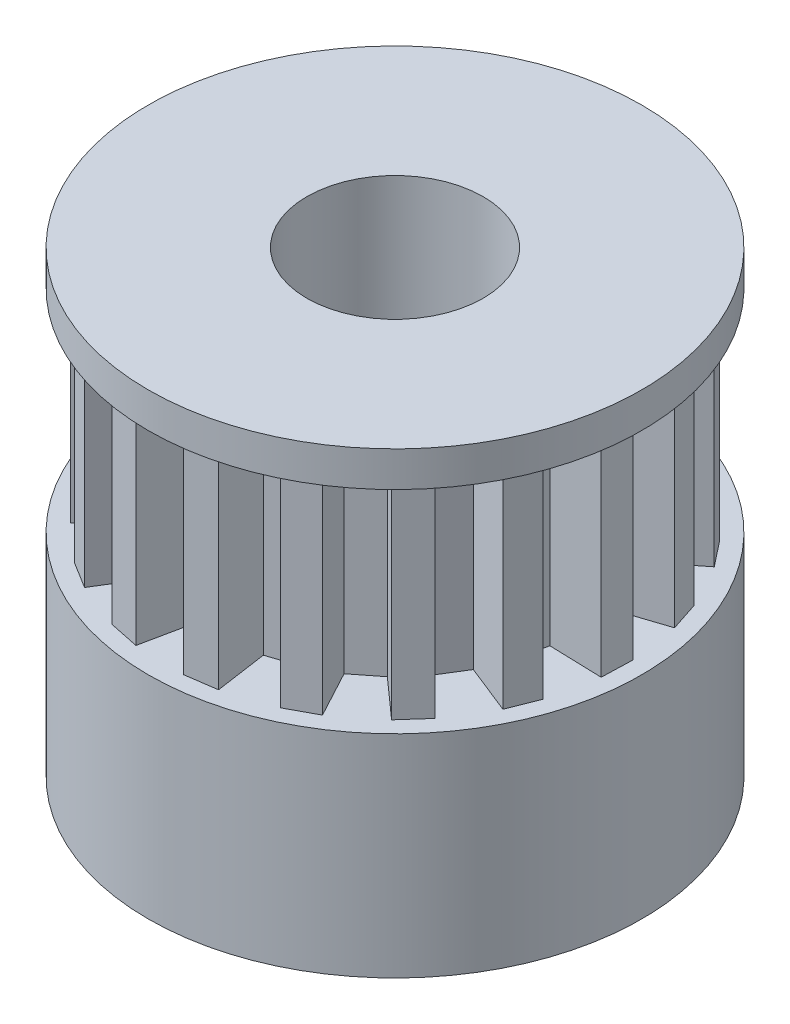
from build123d import *

# Parameters (mm, degrees)
ESTRUSIONE_ESTRUSIONE1_OUTLINE_R = 2.5
ESTRUSIONE_ESTRUSIONE1_DEPTH     = 6
SCHIZZO2_R                       = 7
ESTRUSIONE_ESTRUSIONE2_DEPTH     = 1
FORI_FILETTATI_5_0MM1_D          = 5
ESTRUSIONE_ESTRUSIONE3_START     = 6
SCHIZZO4_R                       = 7
ESTRUSIONE_ESTRUSIONE3_DEPTH     = 6
FORI_FILETTATI_5_0MM2_D          = 5
FORI_FILETTATI_5_0MM2_DEPTH      = 10
FORI_FILETTATI_5_0MM2_TIP        = 1.502151548


# Read off the part's stored shape, not the designer's step: Estrusione-Estrusione1
with BuildPart() as part:
    # Estrusione-Estrusione1 outline → Estrusione-Estrusione1 (new body)
    with BuildSketch(Plane(origin=(0, 0, 0), x_dir=(1, 0, 0), z_dir=(0, 1, 0))):
        Polygon((-4.558413324, 4.655107649), (-5.141001385, 4.002407278), (-4.021493725, 3.00315582), (-4.481890734, 2.259206078), (-5.875647949, 2.815301129), (-6.199864976, 2.002706553), (-4.806107761, 1.446611503), (-4.984293637, 0.590062369), (-6.484192715, 0.635927742), (-6.51093335, -0.238550138), (-5.011034272, -0.284415511), (-4.885517166, -1.15025157), (-6.310648144, -1.620147915), (-6.036687071, -2.451034162), (-4.611556094, -1.981137817), (-4.197475223, -2.751828193), (-5.375946271, -3.680809823), (-4.83432724, -4.367887293), (-3.655856192, -3.438905663), (-3.00315582, -4.021493725), (-3.792825937, -5.297511743), (-3.048876196, -5.757908753), (-2.259206078, -4.481890734), (-1.446611503, -4.806107761), (-1.75223482, -6.275255564), (-0.895685686, -6.45344144), (-0.590062369, -4.984293637), (0.284415511, -5.011034272), (0.499701678, -6.496110952), (1.365537736, -6.370593846), (1.15025157, -4.885517166), (1.981137817, -4.611556094), (2.691366778, -5.933439486), (3.462057155, -5.519358615), (2.751828193, -4.197475223), (3.438905663, -3.655856192), (4.558413324, -4.655107649), (5.141001385, -4.002407278), (4.021493725, -3.00315582), (4.481890734, -2.259206078), (5.875647949, -2.815301129), (6.199864976, -2.002706553), (4.806107761, -1.446611503), (4.984293637, -0.590062369), (6.484192715, -0.635927742), (6.51093335, 0.238550138), (5.011034272, 0.284415511), (4.885517166, 1.15025157), (6.310648144, 1.620147915), (6.036687071, 2.451034162), (4.611556094, 1.981137817), (4.197475223, 2.751828193), (5.375946271, 3.680809823), (4.83432724, 4.367887293), (3.655856192, 3.438905663), (3.00315582, 4.021493725), (3.792825937, 5.297511743), (3.048876196, 5.757908753), (2.259206078, 4.481890734), (1.446611503, 4.806107761), (1.75223482, 6.275255564), (0.895685686, 6.45344144), (0.590062369, 4.984293637), (-0.284415511, 5.011034272), (-0.499701678, 6.496110952), (-1.365537736, 6.370593846), (-1.15025157, 4.885517166), (-1.981137817, 4.611556094), (-2.691366778, 5.933439486), (-3.462057155, 5.519358615), (-2.751828193, 4.197475223), (-3.438905663, 3.655856192), align=None)
        Circle(ESTRUSIONE_ESTRUSIONE1_OUTLINE_R, mode=Mode.SUBTRACT)
    extrude(amount=ESTRUSIONE_ESTRUSIONE1_DEPTH)

    # Schizzo2 → Estrusione-Estrusione2 (add)
    with BuildSketch(Plane(origin=(0, 6, 0), x_dir=(1, 0, 0), z_dir=(0, 1, 0))):
        with Locations(Location((0, 0, 0), (0, 0, 270))):
            Circle(SCHIZZO2_R)
    extrude(amount=ESTRUSIONE_ESTRUSIONE2_DEPTH)

    # Fori filettati Ø5.0mm1 (through all)
    with Locations(Plane.ZX.offset(7)):
        with Locations((0, 0)):
            Hole(FORI_FILETTATI_5_0MM1_D / 2)

    # Schizzo4 → Estrusione-Estrusione3 (add)
    with BuildSketch(Plane.XZ.offset(ESTRUSIONE_ESTRUSIONE3_START)):
        with Locations(Location((0, 0, 0), (0, 0, 90))):
            Circle(SCHIZZO4_R)
    extrude(amount=-ESTRUSIONE_ESTRUSIONE3_DEPTH)

    # Fori filettati Ø5.0mm2
    with Locations(Plane(origin=(0, -6, 0), x_dir=(0, 0, -1), z_dir=(0, -1, 0))):
        with Locations((0, 0)):
            Hole(FORI_FILETTATI_5_0MM2_D / 2, depth=FORI_FILETTATI_5_0MM2_DEPTH)
            with Locations((0, 0, -(FORI_FILETTATI_5_0MM2_DEPTH + FORI_FILETTATI_5_0MM2_TIP / 2))):  # 118° drill point
                Cone(0, FORI_FILETTATI_5_0MM2_D / 2, FORI_FILETTATI_5_0MM2_TIP, mode=Mode.SUBTRACT)


solid = part.part
